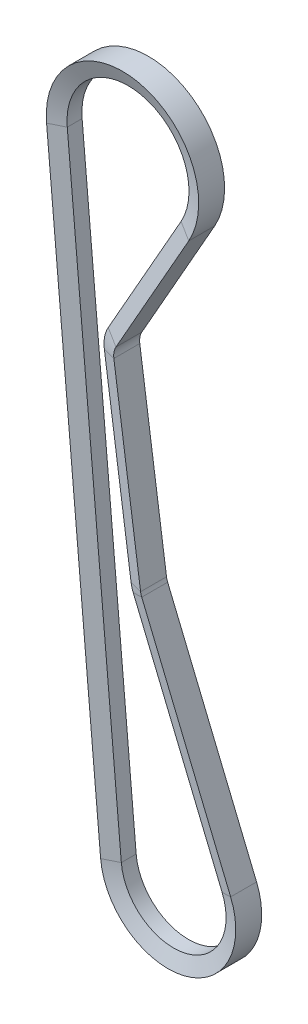
from build123d import *


with BuildPart() as part:
    # Sweep1: sweep along a path in Sketch2
    with BuildLine(Plane.XY) as sweep1_path:
        Line((-24.777859533, -2.196202101), (-44.641088044, 221.903522415))
        ThreePointArc((-44.641088044, 221.903522415), (-10.806750919, 251.737512526), (7.601085089, 210.555223758))
        Line((7.601085089, 210.555223758), (-19.158256452, 163.405336279))
        ThreePointArc((-19.158256452, 163.405336279), (-19.874177527, 161.455823702), (-19.922790611, 159.379582136))
        Line((-19.922790611, 159.379582136), (-10.095412337, 90.072853485))
        ThreePointArc((-10.095412337, 90.072853485), (-9.93432967, 89.292725766), (-9.676842965, 88.53890385))
        Line((-9.676842965, 88.53890385), (22.988969747, 9.50120501))
        ThreePointArc((22.988969747, 9.50120501), (5.916702202, -24.161089829), (-24.777859533, -2.196202101))
    # Sketch3 → Sweep1 (sweep)
    with BuildSketch(Plane(origin=(22.988969747, 9.50120501, 0), x_dir=(-0.9241796870715813, -0.3819579898421739, 0), z_dir=(0.38195798984217383, -0.9241796870715812, 0))):
        Polygon((0, -4.7625), (0, 4.7625), (5.588, 2.728634331), (5.588, -2.728634331), align=None)
    sweep(path=sweep1_path.line)


solid = part.part
